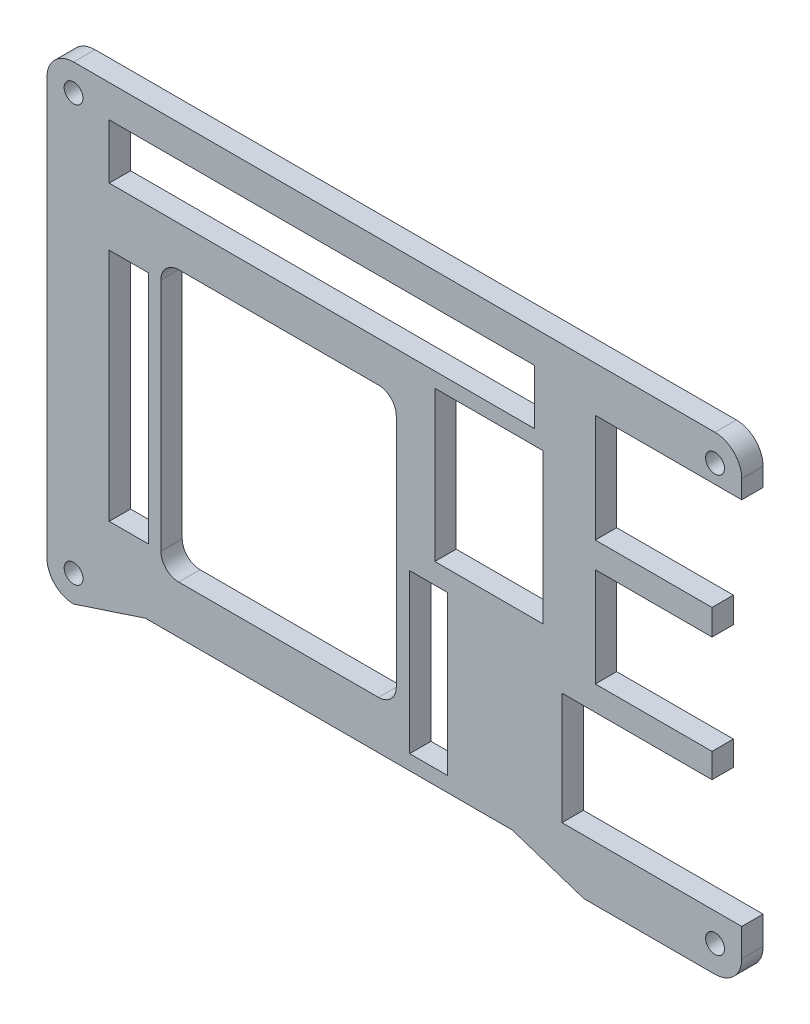
from build123d import *

# Parameters (mm, degrees)
SKETCH1_R           = 1.3462
SKETCH1_W           = 5.4034
SKETCH1_H           = 22.6066
SKETCH1_W_2         = 60.6932
SKETCH1_H_2         = 7.81
SKETCH1_W_3         = 15.431
SKETCH1_H_3         = 21.4039
SKETCH1_W_4         = 31.9679
SKETCH1_H_4         = 18.2371
SKETCH1_W_5         = 5.588
SKETCH1_H_5         = 33.5001
BOSS_EXTRUDE1_DEPTH = 3.048
SKETCH2_W           = 33.5789
SKETCH2_H           = 38.5801
CUT_EXTRUDE1_DEPTH  = 72.310891511
FILLET1_R           = 2.54


with BuildPart() as part:
    # Sketch1 → Boss-Extrude1 (new body)
    with BuildSketch(Plane.XY):
        with BuildLine():
            Line((40.325007375, 24.068294304), (61.214907375, 24.068294304))
            Line((61.214907375, 24.068294304), (61.214907375, 26.683892153))
            ThreePointArc((61.214907375, 26.683892153), (60.103884597, 29.386886916), (57.404932375, 30.507694304))
            Line((57.404932375, 30.507694304), (-34.084892625, 30.507694304))
            ThreePointArc((-34.084892625, 30.507694304), (-36.778969461, 29.391771141), (-37.894892625, 26.697694304))
            Line((-37.894892625, 26.697694304), (-37.894892625, -32.641005696))
            ThreePointArc((-37.894892625, -32.641005696), (-36.778969461, -35.335082532), (-34.084892625, -36.451005696))
            Line((-34.084892625, -36.451005696), (-23.844892625, -33.084405696))
            Line((-23.844892625, -33.084405696), (28.474307375, -33.084405696))
            Line((28.474307375, -33.084405696), (38.714307375, -36.451005696))
            Line((38.714307375, -36.451005696), (57.405007375, -36.451005696))
            ThreePointArc((57.405007375, -36.451005696), (60.108826144, -35.325305244), (61.214907375, -32.613401529))
            Line((61.214907375, -32.613401529), (61.214907375, -28.627805696))
            Line((61.214907375, -28.627805696), (35.575007375, -28.627805696))
            Line((35.575007375, -28.627805696), (35.575007375, -12.628005696))
            Line((35.575007375, -12.628005696), (56.975007375, -12.628005696))
            Line((56.975007375, -12.628005696), (56.975007375, -9.121805696))
            Line((56.975007375, -9.121805696), (40.325007375, -9.121805696))
            Line((40.325007375, -9.121805696), (40.325007375, 4.997894304))
            Line((40.325007375, 4.997894304), (56.975007375, 4.997894304))
            Line((56.975007375, 4.997894304), (56.975007375, 8.658194304))
            Line((56.975007375, 8.658194304), (40.325007375, 8.658194304))
            Line((40.325007375, 8.658194304), (40.325007375, 24.068294304))
        make_face()
        with Locations((57.404932375, 26.697694304)):
            Circle(SKETCH1_R, mode=Mode.SUBTRACT)
        with Locations((57.405007375, -32.641005696)):
            Circle(SKETCH1_R, mode=Mode.SUBTRACT)
        with Locations((-34.084892625, -32.641005696)):
            Circle(SKETCH1_R, mode=Mode.SUBTRACT)
        with Locations((-34.084892625, 26.697694304)):
            Circle(SKETCH1_R, mode=Mode.SUBTRACT)
        with Locations((16.546707375, -19.663505696)):
            Rectangle(SKETCH1_W, SKETCH1_H, mode=Mode.SUBTRACT)
        with Locations((1.341707375, 21.991994304)):
            Rectangle(SKETCH1_W_2, SKETCH1_H_2, mode=Mode.SUBTRACT)
        with Locations((25.156507375, 5.270444304)):
            Rectangle(SKETCH1_W_3, SKETCH1_H_3, mode=Mode.SUBTRACT)
        with Locations((-5.654942625, 1.475544304)):
            Rectangle(SKETCH1_W_4, SKETCH1_H_4, mode=Mode.SUBTRACT)
        with Locations((-26.210892625, -6.948855696)):
            Rectangle(SKETCH1_W_5, SKETCH1_H_5, mode=Mode.SUBTRACT)
    extrude(amount=BOSS_EXTRUDE1_DEPTH)

    # Sketch2 → Cut-Extrude1 (cut, through all)
    with BuildSketch(Plane.XY.offset(3.048)):
        with Locations((-4.849442625, -6.948855696)):
            Rectangle(SKETCH2_W, SKETCH2_H)
    extrude(amount=-CUT_EXTRUDE1_DEPTH, mode=Mode.SUBTRACT)

    # Fillet1
    fillet1_edges = [part.edges().sort_by_distance(p)[0] for p in [
        (11.940007375, -26.238905696, 1.524),
        (-21.638892625, -26.238905696, 1.524),
        (-21.638892625, 12.341194304, 1.524),
        (11.940007375, 12.341194304, 1.524),
    ]]
    fillet(fillet1_edges, radius=FILLET1_R)


solid = part.part
